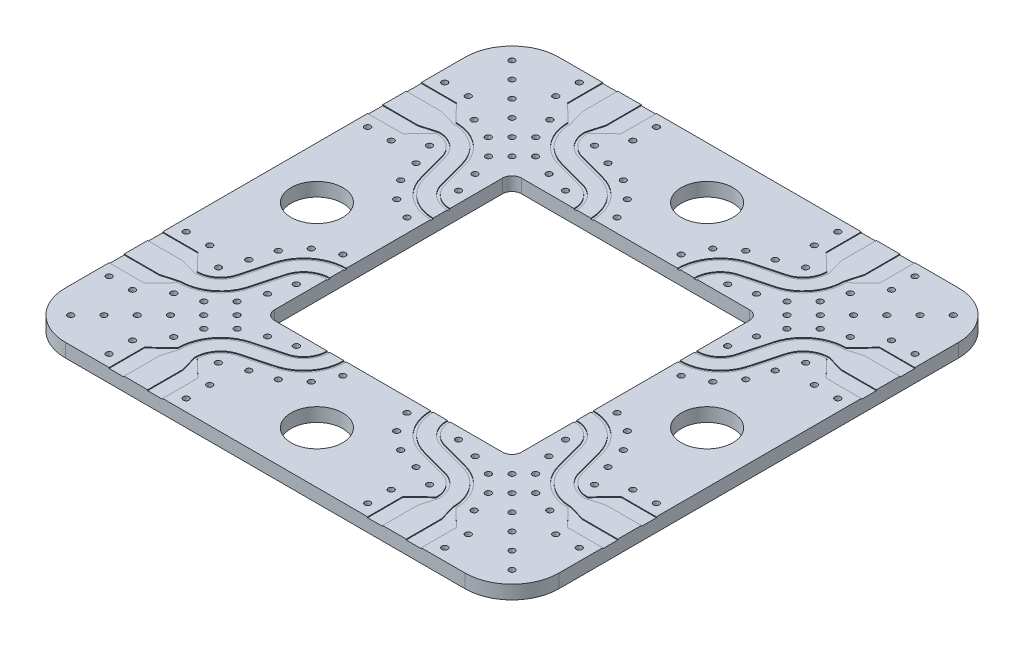
from build123d import *

# Parameters (mm, degrees)
SKETCH1_W           = 21
SKETCH1_H           = 21
BOSS_EXTRUDE1_DEPTH = 0.58
SKETCH2_W           = 10.5
SKETCH2_H           = 10.5
CUT_EXTRUDE1_DEPTH  = 15.860565265
FILLET1_R           = 2
FILLET2_R           = 0.4
CUT_EXTRUDE4_DEPTH  = 0.035
SKETCH5_R           = 1.1
CUT_EXTRUDE5_DEPTH  = 15.860565265
SKETCH6_R           = 0.125
CUT_EXTRUDE6_DEPTH  = 15.860565265
SKETCH7_R           = 0.125
CUT_EXTRUDE7_DEPTH  = 15.860565265


with BuildPart() as part:
    # Sketch1 → Boss-Extrude1 (new body)
    with BuildSketch(Plane(origin=(0, 0, 0), x_dir=(1, 0, 0), z_dir=(0, 1, 0))):
        Rectangle(SKETCH1_W, SKETCH1_H)
    extrude(amount=BOSS_EXTRUDE1_DEPTH)

    # Sketch2 → Cut-Extrude1 (cut, through all)
    with BuildSketch(Plane(origin=(0, 0.58, 0), x_dir=(1, 0, 0), z_dir=(0, 1, 0))):
        Rectangle(SKETCH2_W, SKETCH2_H)
    extrude(amount=-CUT_EXTRUDE1_DEPTH, mode=Mode.SUBTRACT)

    # Fillet1
    fillet1_edges = [part.edges().sort_by_distance(p)[0] for p in [
        (-10.5, 0.29, 10.5),
        (-10.5, 0.29, -10.5),
        (10.5, 0.29, -10.5),
        (10.5, 0.29, 10.5),
    ]]
    fillet(fillet1_edges, radius=FILLET1_R)

    # Fillet2
    fillet2_edges = [part.edges().sort_by_distance(p)[0] for p in [
        (-5.25, 0.29, 5.25),
        (5.25, 0.29, 5.25),
        (5.25, 0.29, -5.25),
        (-5.25, 0.29, -5.25),
    ]]
    fillet(fillet2_edges, radius=FILLET2_R)

    # Sketch3 → Cut-Extrude4 (cut)
    with BuildSketch(Plane(origin=(0, 0.58, 0), x_dir=(1, 0, 0), z_dir=(0, 1, 0))):
        with BuildLine():
            Line((6.321755203, 3.321138814), (6.64891766, 4.535002368))
            ThreePointArc((6.64891766, 4.535002368), (7.260012993, 5.447397151), (8.3, 5.8))
            Line((8.3, 5.8), (9, 6))
            Line((9, 6), (10.5, 6))
            Line((10.5, 6), (10.5, 6.64))
            Line((10.5, 6.64), (9, 6.64))
            Line((9, 6.64), (8.3, 5.91))
            ThreePointArc((8.3, 5.91), (7.193113244, 5.534715096), (6.542707685, 4.563628251))
            Line((6.542707685, 4.563628251), (6.215545228, 3.349764697))
            ThreePointArc((6.215545228, 3.349764697), (5.858179537, 2.816200497), (5.25, 2.61))
            Line((5.25, 2.61), (5.25, 2.5))
            ThreePointArc((5.25, 2.5), (5.925079286, 2.728882551), (6.321755203, 3.321138814))
        make_face()
        with BuildLine():
            Line((5.25, 1.9), (5.25, 1.79))
            ThreePointArc((5.25, 1.79), (6.356886756, 2.165284904), (7.007292315, 3.136371749))
            Line((7.007292315, 3.136371749), (7.334454772, 4.350235303))
            ThreePointArc((7.334454772, 4.350235303), (7.691820463, 4.883799503), (8.3, 5.09))
            Line((8.3, 5.09), (9, 4.36))
            Line((9, 4.36), (10.5, 4.36))
            Line((10.5, 4.36), (10.5, 5))
            Line((10.5, 5), (9, 5))
            Line((9, 5), (8.3, 5.2))
            ThreePointArc((8.3, 5.2), (7.624920714, 4.971117449), (7.228244797, 4.378861186))
            Line((7.228244797, 4.378861186), (6.90108234, 3.164997632))
            ThreePointArc((6.90108234, 3.164997632), (6.289987007, 2.252602849), (5.25, 1.9))
        make_face()
        with BuildLine():
            Line((10.5, -5), (10.5, -4.36))
            Line((10.5, -4.36), (9, -4.36))
            Line((9, -4.36), (8.3, -5.09))
            ThreePointArc((8.3, -5.09), (7.691820463, -4.883799503), (7.334454772, -4.350235303))
            Line((7.334454772, -4.350235303), (7.007292315, -3.136371749))
            ThreePointArc((7.007292315, -3.136371749), (6.356886756, -2.165284904), (5.25, -1.79))
            Line((5.25, -1.79), (5.25, -1.9))
            ThreePointArc((5.25, -1.9), (6.289987007, -2.252602849), (6.90108234, -3.164997632))
            Line((6.90108234, -3.164997632), (7.228244797, -4.378861186))
            ThreePointArc((7.228244797, -4.378861186), (7.624920714, -4.971117449), (8.3, -5.2))
            Line((8.3, -5.2), (9, -5))
            Line((9, -5), (10.5, -5))
        make_face()
        with BuildLine():
            Line((5.25, -2.61), (5.25, -2.5))
            ThreePointArc((5.25, -2.5), (5.925079286, -2.728882551), (6.321755203, -3.321138814))
            Line((6.321755203, -3.321138814), (6.64891766, -4.535002368))
            ThreePointArc((6.64891766, -4.535002368), (7.260012993, -5.447397151), (8.3, -5.8))
            Line((8.3, -5.8), (9, -6))
            Line((9, -6), (10.5, -6))
            Line((10.5, -6), (10.5, -6.64))
            Line((10.5, -6.64), (9, -6.64))
            Line((9, -6.64), (8.3, -5.91))
            ThreePointArc((8.3, -5.91), (7.193113244, -5.534715096), (6.542707685, -4.563628251))
            Line((6.542707685, -4.563628251), (6.215545228, -3.349764697))
            ThreePointArc((6.215545228, -3.349764697), (5.858179537, -2.816200497), (5.25, -2.61))
        make_face()
        with BuildLine():
            Line((-5, -10.5), (-4.36, -10.5))
            Line((-4.36, -10.5), (-4.36, -9))
            Line((-4.36, -9), (-5.09, -8.3))
            ThreePointArc((-5.09, -8.3), (-4.883799503, -7.691820463), (-4.350235303, -7.334454772))
            Line((-4.350235303, -7.334454772), (-3.136371749, -7.007292315))
            ThreePointArc((-3.136371749, -7.007292315), (-2.165284904, -6.356886756), (-1.79, -5.25))
            Line((-1.79, -5.25), (-1.9, -5.25))
            ThreePointArc((-1.9, -5.25), (-2.252602849, -6.289987007), (-3.164997632, -6.90108234))
            Line((-3.164997632, -6.90108234), (-4.378861186, -7.228244797))
            ThreePointArc((-4.378861186, -7.228244797), (-4.971117449, -7.624920714), (-5.2, -8.3))
            Line((-5.2, -8.3), (-5, -9))
            Line((-5, -9), (-5, -10.5))
        make_face()
        with BuildLine():
            Line((-2.61, -5.25), (-2.5, -5.25))
            ThreePointArc((-2.5, -5.25), (-2.728882551, -5.925079286), (-3.321138814, -6.321755203))
            Line((-3.321138814, -6.321755203), (-4.535002368, -6.64891766))
            ThreePointArc((-4.535002368, -6.64891766), (-5.447397151, -7.260012993), (-5.8, -8.3))
            Line((-5.8, -8.3), (-6, -9))
            Line((-6, -9), (-6, -10.5))
            Line((-6, -10.5), (-6.64, -10.5))
            Line((-6.64, -10.5), (-6.64, -9))
            Line((-6.64, -9), (-5.91, -8.3))
            ThreePointArc((-5.91, -8.3), (-5.534715096, -7.193113244), (-4.563628251, -6.542707685))
            Line((-4.563628251, -6.542707685), (-3.349764697, -6.215545228))
            ThreePointArc((-3.349764697, -6.215545228), (-2.816200497, -5.858179537), (-2.61, -5.25))
        make_face()
        with BuildLine():
            Line((6.64, -10.5), (6, -10.5))
            Line((6, -10.5), (6, -9))
            Line((6, -9), (5.8, -8.3))
            ThreePointArc((5.8, -8.3), (5.447397151, -7.260012993), (4.535002368, -6.64891766))
            Line((4.535002368, -6.64891766), (3.321138814, -6.321755203))
            ThreePointArc((3.321138814, -6.321755203), (2.728882551, -5.925079286), (2.5, -5.25))
            Line((2.5, -5.25), (2.61, -5.25))
            ThreePointArc((2.61, -5.25), (2.816200497, -5.858179537), (3.349764697, -6.215545228))
            Line((3.349764697, -6.215545228), (4.563628251, -6.542707685))
            ThreePointArc((4.563628251, -6.542707685), (5.534715096, -7.193113244), (5.91, -8.3))
            Line((5.91, -8.3), (6.64, -9))
            Line((6.64, -9), (6.64, -10.5))
        make_face()
        with BuildLine():
            Line((1.9, -5.25), (1.79, -5.25))
            ThreePointArc((1.79, -5.25), (2.165284904, -6.356886756), (3.136371749, -7.007292315))
            Line((3.136371749, -7.007292315), (4.350235303, -7.334454772))
            ThreePointArc((4.350235303, -7.334454772), (4.883799503, -7.691820463), (5.09, -8.3))
            Line((5.09, -8.3), (4.36, -9))
            Line((4.36, -9), (4.36, -10.5))
            Line((4.36, -10.5), (5, -10.5))
            Line((5, -10.5), (5, -9))
            Line((5, -9), (5.2, -8.3))
            ThreePointArc((5.2, -8.3), (4.971117449, -7.624920714), (4.378861186, -7.228244797))
            Line((4.378861186, -7.228244797), (3.164997632, -6.90108234))
            ThreePointArc((3.164997632, -6.90108234), (2.252602849, -6.289987007), (1.9, -5.25))
        make_face()
        with BuildLine():
            Line((-10.5, 5), (-10.5, 4.36))
            Line((-10.5, 4.36), (-9, 4.36))
            Line((-9, 4.36), (-8.3, 5.09))
            ThreePointArc((-8.3, 5.09), (-7.691820463, 4.883799503), (-7.334454772, 4.350235303))
            Line((-7.334454772, 4.350235303), (-7.007292315, 3.136371749))
            ThreePointArc((-7.007292315, 3.136371749), (-6.356886756, 2.165284904), (-5.25, 1.79))
            Line((-5.25, 1.79), (-5.25, 1.9))
            ThreePointArc((-5.25, 1.9), (-6.289987007, 2.252602849), (-6.90108234, 3.164997632))
            Line((-6.90108234, 3.164997632), (-7.228244797, 4.378861186))
            ThreePointArc((-7.228244797, 4.378861186), (-7.624920714, 4.971117449), (-8.3, 5.2))
            Line((-8.3, 5.2), (-9, 5))
            Line((-9, 5), (-10.5, 5))
        make_face()
        with BuildLine():
            Line((-5.25, 2.61), (-5.25, 2.5))
            ThreePointArc((-5.25, 2.5), (-5.925079286, 2.728882551), (-6.321755203, 3.321138814))
            Line((-6.321755203, 3.321138814), (-6.64891766, 4.535002368))
            ThreePointArc((-6.64891766, 4.535002368), (-7.260012993, 5.447397151), (-8.3, 5.8))
            Line((-8.3, 5.8), (-9, 6))
            Line((-9, 6), (-10.5, 6))
            Line((-10.5, 6), (-10.5, 6.64))
            Line((-10.5, 6.64), (-9, 6.64))
            Line((-9, 6.64), (-8.3, 5.91))
            ThreePointArc((-8.3, 5.91), (-7.193113244, 5.534715096), (-6.542707685, 4.563628251))
            Line((-6.542707685, 4.563628251), (-6.215545228, 3.349764697))
            ThreePointArc((-6.215545228, 3.349764697), (-5.858179537, 2.816200497), (-5.25, 2.61))
        make_face()
        with BuildLine():
            Line((-10.5, -6.64), (-10.5, -6))
            Line((-10.5, -6), (-9, -6))
            Line((-9, -6), (-8.3, -5.8))
            ThreePointArc((-8.3, -5.8), (-7.260012993, -5.447397151), (-6.64891766, -4.535002368))
            Line((-6.64891766, -4.535002368), (-6.321755203, -3.321138814))
            ThreePointArc((-6.321755203, -3.321138814), (-5.925079286, -2.728882551), (-5.25, -2.5))
            Line((-5.25, -2.5), (-5.25, -2.61))
            ThreePointArc((-5.25, -2.61), (-5.858179537, -2.816200497), (-6.215545228, -3.349764697))
            Line((-6.215545228, -3.349764697), (-6.542707685, -4.563628251))
            ThreePointArc((-6.542707685, -4.563628251), (-7.193113244, -5.534715096), (-8.3, -5.91))
            Line((-8.3, -5.91), (-9, -6.64))
            Line((-9, -6.64), (-10.5, -6.64))
        make_face()
        with BuildLine():
            Line((-5.25, -1.9), (-5.25, -1.79))
            ThreePointArc((-5.25, -1.79), (-6.356886756, -2.165284904), (-7.007292315, -3.136371749))
            Line((-7.007292315, -3.136371749), (-7.334454772, -4.350235303))
            ThreePointArc((-7.334454772, -4.350235303), (-7.691820463, -4.883799503), (-8.3, -5.09))
            Line((-8.3, -5.09), (-9, -4.36))
            Line((-9, -4.36), (-10.5, -4.36))
            Line((-10.5, -4.36), (-10.5, -5))
            Line((-10.5, -5), (-9, -5))
            Line((-9, -5), (-8.3, -5.2))
            ThreePointArc((-8.3, -5.2), (-7.624920714, -4.971117449), (-7.228244797, -4.378861186))
            Line((-7.228244797, -4.378861186), (-6.90108234, -3.164997632))
            ThreePointArc((-6.90108234, -3.164997632), (-6.289987007, -2.252602849), (-5.25, -1.9))
        make_face()
        with BuildLine():
            Line((5, 10.5), (4.36, 10.5))
            Line((4.36, 10.5), (4.36, 9))
            Line((4.36, 9), (5.09, 8.3))
            ThreePointArc((5.09, 8.3), (4.883799503, 7.691820463), (4.350235303, 7.334454772))
            Line((4.350235303, 7.334454772), (3.136371749, 7.007292315))
            ThreePointArc((3.136371749, 7.007292315), (2.165284904, 6.356886756), (1.79, 5.25))
            Line((1.79, 5.25), (1.9, 5.25))
            ThreePointArc((1.9, 5.25), (2.252602849, 6.289987007), (3.164997632, 6.90108234))
            Line((3.164997632, 6.90108234), (4.378861186, 7.228244797))
            ThreePointArc((4.378861186, 7.228244797), (4.971117449, 7.624920714), (5.2, 8.3))
            Line((5.2, 8.3), (5, 9))
            Line((5, 9), (5, 10.5))
        make_face()
        with BuildLine():
            Line((2.61, 5.25), (2.5, 5.25))
            ThreePointArc((2.5, 5.25), (2.728882551, 5.925079286), (3.321138814, 6.321755203))
            Line((3.321138814, 6.321755203), (4.535002368, 6.64891766))
            ThreePointArc((4.535002368, 6.64891766), (5.447397151, 7.260012993), (5.8, 8.3))
            Line((5.8, 8.3), (6, 9))
            Line((6, 9), (6, 10.5))
            Line((6, 10.5), (6.64, 10.5))
            Line((6.64, 10.5), (6.64, 9))
            Line((6.64, 9), (5.91, 8.3))
            ThreePointArc((5.91, 8.3), (5.534715096, 7.193113244), (4.563628251, 6.542707685))
            Line((4.563628251, 6.542707685), (3.349764697, 6.215545228))
            ThreePointArc((3.349764697, 6.215545228), (2.816200497, 5.858179537), (2.61, 5.25))
        make_face()
        with BuildLine():
            Line((-6.64, 10.5), (-6, 10.5))
            Line((-6, 10.5), (-6, 9))
            Line((-6, 9), (-5.8, 8.3))
            ThreePointArc((-5.8, 8.3), (-5.447397151, 7.260012993), (-4.535002368, 6.64891766))
            Line((-4.535002368, 6.64891766), (-3.321138814, 6.321755203))
            ThreePointArc((-3.321138814, 6.321755203), (-2.728882551, 5.925079286), (-2.5, 5.25))
            Line((-2.5, 5.25), (-2.61, 5.25))
            ThreePointArc((-2.61, 5.25), (-2.816200497, 5.858179537), (-3.349764697, 6.215545228))
            Line((-3.349764697, 6.215545228), (-4.563628251, 6.542707685))
            ThreePointArc((-4.563628251, 6.542707685), (-5.534715096, 7.193113244), (-5.91, 8.3))
            Line((-5.91, 8.3), (-6.64, 9))
            Line((-6.64, 9), (-6.64, 10.5))
        make_face()
        with BuildLine():
            Line((-1.9, 5.25), (-1.79, 5.25))
            ThreePointArc((-1.79, 5.25), (-2.165284904, 6.356886756), (-3.136371749, 7.007292315))
            Line((-3.136371749, 7.007292315), (-4.350235303, 7.334454772))
            ThreePointArc((-4.350235303, 7.334454772), (-4.883799503, 7.691820463), (-5.09, 8.3))
            Line((-5.09, 8.3), (-4.36, 9))
            Line((-4.36, 9), (-4.36, 10.5))
            Line((-4.36, 10.5), (-5, 10.5))
            Line((-5, 10.5), (-5, 9))
            Line((-5, 9), (-5.2, 8.3))
            ThreePointArc((-5.2, 8.3), (-4.971117449, 7.624920714), (-4.378861186, 7.228244797))
            Line((-4.378861186, 7.228244797), (-3.164997632, 6.90108234))
            ThreePointArc((-3.164997632, 6.90108234), (-2.252602849, 6.289987007), (-1.9, 5.25))
        make_face()
    extrude(amount=-CUT_EXTRUDE4_DEPTH, mode=Mode.SUBTRACT)

    # Sketch5 → Cut-Extrude5 (cut, through all)
    with BuildSketch(Plane(origin=(0, 0.58, 0), x_dir=(1, 0, 0), z_dir=(0, 1, 0))):
        with Locations((0, 8.3)):
            Circle(SKETCH5_R)
        with Locations((8.3, 0)):
            Circle(SKETCH5_R)
        with Locations((0, -8.3)):
            Circle(SKETCH5_R)
        with Locations((-8.3, 0)):
            Circle(SKETCH5_R)
    extrude(amount=-CUT_EXTRUDE5_DEPTH, mode=Mode.SUBTRACT)

    # Sketch6 → Cut-Extrude6 (cut, through all)
    with BuildSketch(Plane(origin=(0, 0.58, 0), x_dir=(1, 0, 0), z_dir=(0, 1, 0))):
        with Locations((8, 4.49)):
            Circle(SKETCH6_R)
        with Locations((10, 3.86)):
            Circle(SKETCH6_R)
        with Locations((-10, 3.86)):
            Circle(SKETCH6_R)
        with Locations((-9, 3.86)):
            Circle(SKETCH6_R)
        with Locations((5.723678757, 3.449911163)):
            Circle(SKETCH6_R)
        with Locations((5.830725093, 1.363857002)):
            Circle(SKETCH6_R)
        with Locations((6.722191664, 1.816943475)):
            Circle(SKETCH6_R)
        with Locations((7.340138679, 2.603163219)):
            Circle(SKETCH6_R)
        with Locations((7.638655803, 3.557567498)):
            Circle(SKETCH6_R)
        with Locations((6.349595127, 5.346312395)):
            Circle(SKETCH6_R)
        with Locations((7.0595671, 6.050542328)):
            Circle(SKETCH6_R)
        with Locations((8, 6.39052168)):
            Circle(SKETCH6_R)
        with Locations((9, 7.14)):
            Circle(SKETCH6_R)
        with Locations((10, 7.14)):
            Circle(SKETCH6_R)
        with Locations((9, 3.86)):
            Circle(SKETCH6_R)
        with Locations((5.984861105, 4.415200644)):
            Circle(SKETCH6_R)
        with Locations((-8, 4.49)):
            Circle(SKETCH6_R)
        with Locations((-7.638655803, 3.557567498)):
            Circle(SKETCH6_R)
        with Locations((-7.340138679, 2.603163219)):
            Circle(SKETCH6_R)
        with Locations((-6.722191664, 1.816943475)):
            Circle(SKETCH6_R)
        with Locations((-5.830725093, 1.363857002)):
            Circle(SKETCH6_R)
        with Locations((-5.723678757, 3.449911163)):
            Circle(SKETCH6_R)
        with Locations((-5.984861105, 4.415200644)):
            Circle(SKETCH6_R)
        with Locations((-6.349595127, 5.346312395)):
            Circle(SKETCH6_R)
        with Locations((-7.0595671, 6.050542328)):
            Circle(SKETCH6_R)
        with Locations((-8, 6.39052168)):
            Circle(SKETCH6_R)
        with Locations((-9, 7.14)):
            Circle(SKETCH6_R)
        with Locations((-10, 7.14)):
            Circle(SKETCH6_R)
        with Locations((3.86, 10)):
            Circle(SKETCH6_R)
        with Locations((3.86, 9)):
            Circle(SKETCH6_R)
        with Locations((4.49, 8)):
            Circle(SKETCH6_R)
        with Locations((3.557567498, 7.638655803)):
            Circle(SKETCH6_R)
        with Locations((2.603163219, 7.340138679)):
            Circle(SKETCH6_R)
        with Locations((1.816943475, 6.722191664)):
            Circle(SKETCH6_R)
        with Locations((1.363857002, 5.830725093)):
            Circle(SKETCH6_R)
        with Locations((3.449911163, 5.723678757)):
            Circle(SKETCH6_R)
        with Locations((4.415200644, 5.984861105)):
            Circle(SKETCH6_R)
        with Locations((5.346312395, 6.349595127)):
            Circle(SKETCH6_R)
        with Locations((6.050542328, 7.0595671)):
            Circle(SKETCH6_R)
        with Locations((6.39052168, 8)):
            Circle(SKETCH6_R)
        with Locations((7.14, 9)):
            Circle(SKETCH6_R)
        with Locations((7.14, 10)):
            Circle(SKETCH6_R)
        with Locations((7.14, -10)):
            Circle(SKETCH6_R)
        with Locations((7.14, -9)):
            Circle(SKETCH6_R)
        with Locations((6.39052168, -8)):
            Circle(SKETCH6_R)
        with Locations((6.050542328, -7.0595671)):
            Circle(SKETCH6_R)
        with Locations((5.346312395, -6.349595127)):
            Circle(SKETCH6_R)
        with Locations((4.415200644, -5.984861105)):
            Circle(SKETCH6_R)
        with Locations((3.449911163, -5.723678757)):
            Circle(SKETCH6_R)
        with Locations((1.363857002, -5.830725093)):
            Circle(SKETCH6_R)
        with Locations((1.816943475, -6.722191664)):
            Circle(SKETCH6_R)
        with Locations((2.603163219, -7.340138679)):
            Circle(SKETCH6_R)
        with Locations((3.557567498, -7.638655803)):
            Circle(SKETCH6_R)
        with Locations((4.49, -8)):
            Circle(SKETCH6_R)
        with Locations((3.86, -9)):
            Circle(SKETCH6_R)
        with Locations((3.86, -10)):
            Circle(SKETCH6_R)
        with Locations((10, -3.86)):
            Circle(SKETCH6_R)
        with Locations((9, -3.86)):
            Circle(SKETCH6_R)
        with Locations((8, -4.49)):
            Circle(SKETCH6_R)
        with Locations((7.638655803, -3.557567498)):
            Circle(SKETCH6_R)
        with Locations((7.340138679, -2.603163219)):
            Circle(SKETCH6_R)
        with Locations((6.722191664, -1.816943475)):
            Circle(SKETCH6_R)
        with Locations((5.830725093, -1.363857002)):
            Circle(SKETCH6_R)
        with Locations((5.723678757, -3.449911163)):
            Circle(SKETCH6_R)
        with Locations((5.984861105, -4.415200644)):
            Circle(SKETCH6_R)
        with Locations((6.349595127, -5.346312395)):
            Circle(SKETCH6_R)
        with Locations((7.0595671, -6.050542328)):
            Circle(SKETCH6_R)
        with Locations((8, -6.39052168)):
            Circle(SKETCH6_R)
        with Locations((9, -7.14)):
            Circle(SKETCH6_R)
        with Locations((10, -7.14)):
            Circle(SKETCH6_R)
        with Locations((-10, -7.14)):
            Circle(SKETCH6_R)
        with Locations((-9, -7.14)):
            Circle(SKETCH6_R)
        with Locations((-8, -6.39052168)):
            Circle(SKETCH6_R)
        with Locations((-7.0595671, -6.050542328)):
            Circle(SKETCH6_R)
        with Locations((-6.349595127, -5.346312395)):
            Circle(SKETCH6_R)
        with Locations((-5.984861105, -4.415200644)):
            Circle(SKETCH6_R)
        with Locations((-5.723678757, -3.449911163)):
            Circle(SKETCH6_R)
        with Locations((-5.830725093, -1.363857002)):
            Circle(SKETCH6_R)
        with Locations((-6.722191664, -1.816943475)):
            Circle(SKETCH6_R)
        with Locations((-7.340138679, -2.603163219)):
            Circle(SKETCH6_R)
        with Locations((-7.638655803, -3.557567498)):
            Circle(SKETCH6_R)
        with Locations((-8, -4.49)):
            Circle(SKETCH6_R)
        with Locations((-9, -3.86)):
            Circle(SKETCH6_R)
        with Locations((-10, -3.86)):
            Circle(SKETCH6_R)
        with Locations((-3.86, -10)):
            Circle(SKETCH6_R)
        with Locations((-3.86, -9)):
            Circle(SKETCH6_R)
        with Locations((-4.49, -8)):
            Circle(SKETCH6_R)
        with Locations((-3.557567498, -7.638655803)):
            Circle(SKETCH6_R)
        with Locations((-2.603163219, -7.340138679)):
            Circle(SKETCH6_R)
        with Locations((-1.816943475, -6.722191664)):
            Circle(SKETCH6_R)
        with Locations((-1.363857002, -5.830725093)):
            Circle(SKETCH6_R)
        with Locations((-3.449911163, -5.723678757)):
            Circle(SKETCH6_R)
        with Locations((-4.415200644, -5.984861105)):
            Circle(SKETCH6_R)
        with Locations((-5.346312395, -6.349595127)):
            Circle(SKETCH6_R)
        with Locations((-6.050542328, -7.0595671)):
            Circle(SKETCH6_R)
        with Locations((-6.39052168, -8)):
            Circle(SKETCH6_R)
        with Locations((-7.14, -9)):
            Circle(SKETCH6_R)
        with Locations((-7.14, -10)):
            Circle(SKETCH6_R)
        with Locations((-7.14, 10)):
            Circle(SKETCH6_R)
        with Locations((-7.14, 9)):
            Circle(SKETCH6_R)
        with Locations((-6.39052168, 8)):
            Circle(SKETCH6_R)
        with Locations((-6.050542328, 7.0595671)):
            Circle(SKETCH6_R)
        with Locations((-5.346312395, 6.349595127)):
            Circle(SKETCH6_R)
        with Locations((-4.415200644, 5.984861105)):
            Circle(SKETCH6_R)
        with Locations((-3.449911163, 5.723678757)):
            Circle(SKETCH6_R)
        with Locations((-1.363857002, 5.830725093)):
            Circle(SKETCH6_R)
        with Locations((-1.816943475, 6.722191664)):
            Circle(SKETCH6_R)
        with Locations((-2.603163219, 7.340138679)):
            Circle(SKETCH6_R)
        with Locations((-3.557567498, 7.638655803)):
            Circle(SKETCH6_R)
        with Locations((-4.49, 8)):
            Circle(SKETCH6_R)
        with Locations((-3.86, 9)):
            Circle(SKETCH6_R)
        with Locations((-3.86, 10)):
            Circle(SKETCH6_R)
    extrude(amount=-CUT_EXTRUDE6_DEPTH, mode=Mode.SUBTRACT)

    # Sketch7 → Cut-Extrude7 (cut, through all)
    with BuildSketch(Plane(origin=(0, 0.58, 0), x_dir=(1, 0, 0), z_dir=(0, 1, 0))):
        with Locations((5.85, 5.85)):
            Circle(SKETCH7_R)
        with Locations((6.557106781, 6.557106781)):
            Circle(SKETCH7_R)
        with Locations((7.264213562, 7.264213562)):
            Circle(SKETCH7_R)
        with Locations((7.971320344, 7.971320344)):
            Circle(SKETCH7_R)
        with Locations((8.678427125, 8.678427125)):
            Circle(SKETCH7_R)
        with Locations((9.385533906, 9.385533906)):
            Circle(SKETCH7_R)
        with Locations((5.85, -5.85)):
            Circle(SKETCH7_R)
        with Locations((6.557106781, -6.557106781)):
            Circle(SKETCH7_R)
        with Locations((7.264213562, -7.264213562)):
            Circle(SKETCH7_R)
        with Locations((7.971320344, -7.971320344)):
            Circle(SKETCH7_R)
        with Locations((8.678427125, -8.678427125)):
            Circle(SKETCH7_R)
        with Locations((9.385533906, -9.385533906)):
            Circle(SKETCH7_R)
        with Locations((-5.85, -5.85)):
            Circle(SKETCH7_R)
        with Locations((-6.557106781, -6.557106781)):
            Circle(SKETCH7_R)
        with Locations((-7.264213562, -7.264213562)):
            Circle(SKETCH7_R)
        with Locations((-7.971320344, -7.971320344)):
            Circle(SKETCH7_R)
        with Locations((-8.678427125, -8.678427125)):
            Circle(SKETCH7_R)
        with Locations((-9.385533906, -9.385533906)):
            Circle(SKETCH7_R)
        with Locations((-5.85, 5.85)):
            Circle(SKETCH7_R)
        with Locations((-6.557106781, 6.557106781)):
            Circle(SKETCH7_R)
        with Locations((-7.264213562, 7.264213562)):
            Circle(SKETCH7_R)
        with Locations((-7.971320344, 7.971320344)):
            Circle(SKETCH7_R)
        with Locations((-8.678427125, 8.678427125)):
            Circle(SKETCH7_R)
        with Locations((-9.385533906, 9.385533906)):
            Circle(SKETCH7_R)
    extrude(amount=-CUT_EXTRUDE7_DEPTH, mode=Mode.SUBTRACT)


solid = part.part
